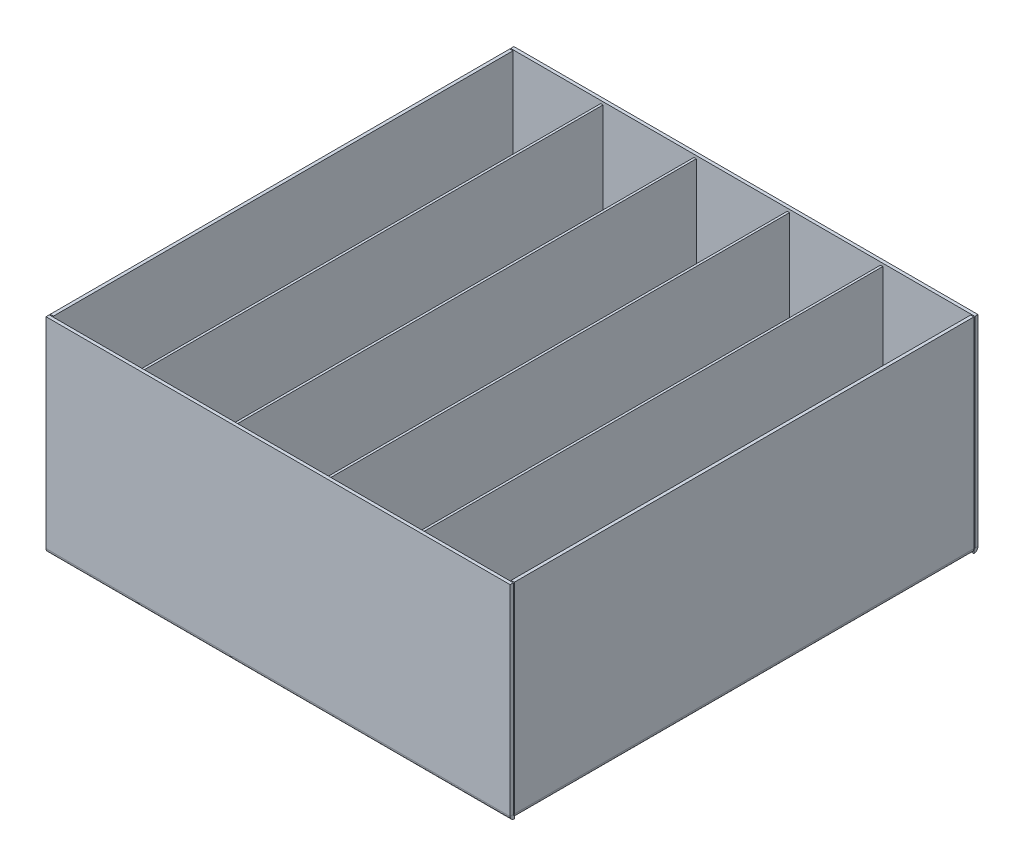
from build123d import *

# Parameters (mm, degrees)
SKETCH1_W                      = 464.2
SKETCH1_H                      = 468
BASE_FLANGE1_DEPTH             = 3.2
EDGE_FLANGE1_STRIP_W           = 14.8
EDGE_FLANGE1_STRIP_H           = 3.2
EDGE_FLANGE1_STRIP_CUT_DEPTH   = 464.2
EDGE_FLANGE1_DEPTH             = 464.2
EDGE_FLANGE2_STRIP_W           = 14.8
EDGE_FLANGE2_STRIP_H           = 3.2
EDGE_FLANGE2_STRIP_CUT_DEPTH   = 464.2
EDGE_FLANGE2_DEPTH             = 464.2
SKETCH12_W                     = 2.3
SKETCH12_H                     = 459.6
SKETCH12_H_2                   = 462.8
SKETCH12_H_3                   = 463.8
BOSS_EXTRUDE1_DEPTH            = 200
EDGE_FLANGE3_STRIP_W           = 14.8
EDGE_FLANGE3_STRIP_H           = 3.2
EDGE_FLANGE3_STRIP_CUT_DEPTH   = 459.6
EDGE_FLANGE3_STRIP_2_W         = 14.8
EDGE_FLANGE3_STRIP_2_H         = 3.2
EDGE_FLANGE3_STRIP_CUT_2_DEPTH = 459.6
EDGE_FLANGE3_DEPTH             = 459.6
EDGE_FLANGE3_BEND_DEPTH        = 459.6


# Sheet-metal steps are written as plain solids
with BuildPart() as part:
    # Sketch1 → Base-Flange1 (new body)
    with BuildSketch(Plane(origin=(0, 0, 0), x_dir=(1, 0, 0), z_dir=(0, 1, 0))):
        with Locations((23.545430809, -47.580156658)):
            Rectangle(SKETCH1_W, SKETCH1_H)
    extrude(amount=-BASE_FLANGE1_DEPTH)

    # Edge-Flange1 strip (across the edge) → Edge-Flange1 strip cut (cut)
    with BuildSketch(Plane(origin=(255.645430809, 0, -186.419843342), x_dir=(0, 0, 1), z_dir=(-1, 0, 0))):
        with Locations((-3.2, -1.6)):
            Rectangle(EDGE_FLANGE1_STRIP_W, EDGE_FLANGE1_STRIP_H)
    extrude(amount=EDGE_FLANGE1_STRIP_CUT_DEPTH, mode=Mode.SUBTRACT)

    # Edge-Flange1 section (across the edge) → Edge-Flange1 (add)
    with BuildSketch(Plane(origin=(255.645430809, 0, -186.419843342), x_dir=(0, 0, 1), z_dir=(-1, 0, 0))):
        with BuildLine():
            Line((0, 1), (0, 201.8))
            Line((0, 201.8), (3.2, 201.8))
            Line((3.2, 201.8), (3.2, 1))
            ThreePointArc((3.2, 1), (3.492893219, 0.292893219), (4.2, 0))
            Line((4.2, 0), (4.2, -3.2))
            ThreePointArc((4.2, -3.2), (1.230151519, -1.969848481), (0, 1))
        make_face()
    extrude(amount=EDGE_FLANGE1_DEPTH)

    # Edge-Flange2 strip (across the edge) → Edge-Flange2 strip cut (cut)
    with BuildSketch(Plane(origin=(-208.554569191, 0, 281.580156658), x_dir=(0, 0, -1), z_dir=(1, 0, 0))):
        with Locations((-3.2, -1.6)):
            Rectangle(EDGE_FLANGE2_STRIP_W, EDGE_FLANGE2_STRIP_H)
    extrude(amount=EDGE_FLANGE2_STRIP_CUT_DEPTH, mode=Mode.SUBTRACT)

    # Edge-Flange2 section (across the edge) → Edge-Flange2 (add)
    with BuildSketch(Plane(origin=(-208.554569191, 0, 281.580156658), x_dir=(0, 0, -1), z_dir=(1, 0, 0))):
        with BuildLine():
            Line((0, 1), (0, 201.8))
            Line((0, 201.8), (3.2, 201.8))
            Line((3.2, 201.8), (3.2, 1))
            ThreePointArc((3.2, 1), (3.492893219, 0.292893219), (4.2, 0))
            Line((4.2, 0), (4.2, -3.2))
            ThreePointArc((4.2, -3.2), (1.230151519, -1.969848481), (0, 1))
        make_face()
    extrude(amount=EDGE_FLANGE2_DEPTH)

    # Sketch12 → Boss-Extrude1 (add)
    with BuildSketch(Plane(origin=(0, 0, 0), x_dir=(1, 0, 0), z_dir=(0, 1, 0))):
        with Locations((163.495430809, -47.580156658)):
            Rectangle(SKETCH12_W, SKETCH12_H)
        with Locations((70.195430809, -49.180156658)):
            Rectangle(SKETCH12_W, SKETCH12_H_2)
        with Locations((-23.104569191, -49.680156658)):
            Rectangle(SKETCH12_W, SKETCH12_H_3)
        with Locations((-116.404569191, -49.680156658)):
            Rectangle(SKETCH12_W, SKETCH12_H_3)
    extrude(amount=BOSS_EXTRUDE1_DEPTH)

    # Edge-Flange3 strip (across the edge) → Edge-Flange3 strip cut (cut)
    with BuildSketch(Plane(origin=(255.645430809, 0, 277.380156658), x_dir=(-1, 0, 0), z_dir=(0, 0, -1))):
        with Locations((-3.2, -1.6)):
            Rectangle(EDGE_FLANGE3_STRIP_W, EDGE_FLANGE3_STRIP_H)
    extrude(amount=EDGE_FLANGE3_STRIP_CUT_DEPTH, mode=Mode.SUBTRACT)

    # Edge-Flange3 strip 2 (across the edge) → Edge-Flange3 strip cut 2 (cut)
    with BuildSketch(Plane(origin=(-208.554569191, 0, -182.219843342), x_dir=(1, 0, 0), z_dir=(0, 0, 1))):
        with Locations((-3.2, -1.6)):
            Rectangle(EDGE_FLANGE3_STRIP_2_W, EDGE_FLANGE3_STRIP_2_H)
    extrude(amount=EDGE_FLANGE3_STRIP_CUT_2_DEPTH, mode=Mode.SUBTRACT)

    # Edge-Flange3 section (across the edge) → Edge-Flange3 (add)
    with BuildSketch(Plane(origin=(255.645430809, 0, 277.380156658), x_dir=(-1, 0, 0), z_dir=(0, 0, -1))):
        with BuildLine():
            Line((0, 1), (0, 201.8))
            Line((0, 201.8), (3.2, 201.8))
            Line((3.2, 201.8), (3.2, 1))
            ThreePointArc((3.2, 1), (3.492893219, 0.292893219), (4.2, 0))
            Line((4.2, 0), (4.2, -3.2))
            ThreePointArc((4.2, -3.2), (1.230151519, -1.969848481), (0, 1))
        make_face()
    extrude(amount=EDGE_FLANGE3_DEPTH)

    # Edge-Flange3 section 2 (across the edge) → Edge-Flange3 bend (add)
    with BuildSketch(Plane(origin=(-208.554569191, 0, -182.219843342), x_dir=(1, 0, 0), z_dir=(0, 0, 1))):
        with BuildLine():
            Line((0, 1), (0, 201.8))
            Line((0, 201.8), (3.2, 201.8))
            Line((3.2, 201.8), (3.2, 1))
            ThreePointArc((3.2, 1), (3.492893219, 0.292893219), (4.2, 0))
            Line((4.2, 0), (4.2, -3.2))
            ThreePointArc((4.2, -3.2), (1.230151519, -1.969848481), (0, 1))
        make_face()
    extrude(amount=EDGE_FLANGE3_BEND_DEPTH)


solid = part.part
